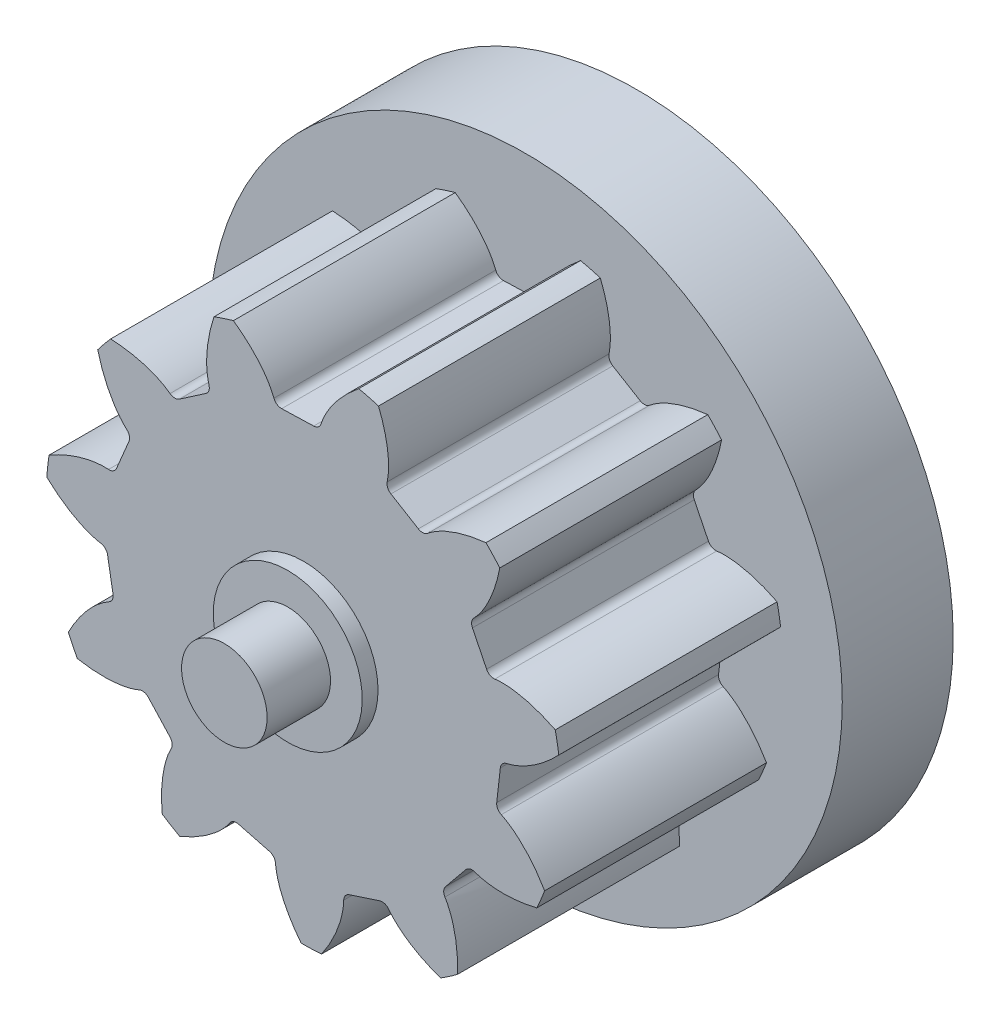
from build123d import *

# Parameters (mm, degrees)
SKETCH2_R                = 8.125
BOSS_EXTRUDE1_DEPTH      = 7
CUT_EXTRUDE1_DEPTH       = 7
FILLET1_R                = 0.254
CIRPATTERN3_COUNT        = 11
FILLET1_OF_CIRPATTERN3_R = 0.254
SKETCH10_R               = 1.8
CUT_EXTRUDE3_DEPTH       = 4
BOSS_EXTRUDE2_START      = 3.5
SKETCH11_R               = 10
SKETCH11_R_2             = 1.8
BOSS_EXTRUDE2_DEPTH      = 3.5
SKETCH12_R               = 3.3
CUT_EXTRUDE4_DEPTH       = 2.5


# Read off the part's stored shape, not the designer's step: Cut-Extrude1
with BuildPart() as part:
    # Sketch2 → Boss-Extrude1 (new body)
    with BuildSketch(Plane.XY):
        Circle(SKETCH2_R)
    extrude(amount=BOSS_EXTRUDE1_DEPTH)

    # Cut-Extrude1 outline → Cut-Extrude1 (cut)
    with BuildSketch(Plane.XY):
        with BuildLine():
            add(Edge.make_bspline(
                [(6.230866036, 0), (6.235473566, 0), (6.248392879, 0.000301816), (6.272788752, 0.002063982), (6.312468264, 0.006627701), (6.362772665, 0.014915466), (6.427377148, 0.028451165), (6.502836081, 0.04800427), (6.584940383, 0.073240914), (6.673231189, 0.104698853), (6.760286137, 0.139587561), (6.846067267, 0.177612608), (6.93049542, 0.218374425), (7.031447847, 0.271104951), (7.150597351, 0.338972511), (7.28681308, 0.424902383), (7.437483479, 0.530044423), (7.586576545, 0.645159253), (7.729488298, 0.764898307), (7.865628813, 0.88978132), (7.961316066, 0.983260547), (8.023830686, 1.04791121), (8.053063977, 1.078788946)],
                knots=[0, 0, 0, 0, 0, 0.005376748, 0.015083688, 0.02853182, 0.046610139, 0.064854849, 0.092110525, 0.119476175, 0.146842495, 0.174208853, 0.201574955, 0.228941013, 0.256307345, 0.307035032, 0.361767351, 0.41649966, 0.471231936, 0.525964281, 0.580696615, 0.629881812, 0.629881812, 0.629881812, 0.629881812, 0.629881812], degree=4))
            Line((6.230866036, 0), (6.072908509, -1.39408529))
            add(Edge.make_bspline(
                [(7.607545512, -2.853222087), (7.585961851, -2.816586512), (7.539496877, -2.739587861), (7.467150286, -2.627069476), (7.362402195, -2.47489246), (7.249903621, -2.326214012), (7.130345817, -2.180659561), (7.007019369, -2.044472173), (6.89348265, -1.930243975), (6.792538275, -1.837438569), (6.70594293, -1.76345785), (6.632775091, -1.70483954), (6.557676253, -1.648585909), (6.48063417, -1.595104105), (6.401619963, -1.544689589), (6.327243484, -1.501722811), (6.258072281, -1.465782317), (6.198134032, -1.438135242), (6.150959182, -1.418802542), (6.113306658, -1.405476679), (6.089923505, -1.398300886), (6.077399235, -1.395116172), (6.072908509, -1.39408529)],
                knots=[0.279209104, 0.279209104, 0.279209104, 0.279209104, 0.279209104, 0.328394301, 0.383126635, 0.43785898, 0.492591256, 0.547323565, 0.602055884, 0.652783571, 0.680149903, 0.707515961, 0.734882063, 0.762248421, 0.789614741, 0.816980391, 0.844236067, 0.862480777, 0.880559096, 0.894007228, 0.903714168, 0.909090916, 0.909090916, 0.909090916, 0.909090916, 0.909090916], degree=4))
            ThreePointArc((7.607545512, -2.853222087), (8.07334194, -0.914754021), (8.053063977, 1.078788946))
        make_face()
    cut_extrude1 = extrude(amount=CUT_EXTRUDE1_DEPTH, mode=Mode.SUBTRACT)

    # Fillet1
    fillet1_edges = [part.edges().sort_by_distance(p)[0] for p in [
        (6.072908509, -1.39408529, 3.5),
        (6.230866036, 0, 3.5),
    ]]
    fillet(fillet1_edges, radius=FILLET1_R)

    # CirPattern3: Cut-Extrude1 ×11 about axis
    cirpattern3_axis = Axis((0, 0, 18.908609159), (0, 0, -1))
    for i in range(1, CIRPATTERN3_COUNT):
        add(cut_extrude1.rotate(cirpattern3_axis, i * 360 / CIRPATTERN3_COUNT), mode=Mode.SUBTRACT)

    # Fillet1 of CirPattern3
    fillet1_of_cirpattern3_edges = [part.edges().sort_by_distance(p)[0] for p in [
        (4.355156327, -4.456041396, 3.5),
        (5.241738065, -3.368660507, 3.5),
        (1.254672783, -6.103235844, 3.5),
        (2.588395295, -5.667795105, 3.5),
        (-2.244160504, -5.812696034, 3.5),
        (-0.886744692, -6.167444804, 3.5),
        (-5.030488688, -3.676666305, 3.5),
        (-4.080349505, -4.708974355, 3.5),
        (-6.219672257, -0.373321001, 3.5),
        (-5.978472181, -1.75543782, 3.5),
        (-5.434153831, 3.048551082, 3.5),
        (-5.978472181, 1.75543782, 3.5),
        (-2.923329959, 5.502529737, 3.5),
        (-4.080349505, 4.708974355, 3.5),
        (0.51563052, 6.209494079, 3.5),
        (-0.886744692, 6.167444804, 3.5),
        (3.790881951, 4.944987926, 3.5),
        (2.588395295, 5.667795105, 3.5),
        (5.862555149, 2.110483045, 3.5),
        (5.241738065, 3.368660507, 3.5),
    ]]
    fillet(fillet1_of_cirpattern3_edges, radius=FILLET1_OF_CIRPATTERN3_R)

    # Sketch9 → Revolve1 (revolve)
    with BuildSketch(Plane(origin=(0, 0, 0), x_dir=(0, 0, -1), z_dir=(1, 0, 0))):
        Polygon((-9.5, 0), (-9.5, 1.35), (-7.5, 1.35), (-7.5, 2.35), (-7, 2.35), (-7, 0), align=None)
    revolve(axis=Axis((0, 0, 7), (0, 0, 1)))

    # Sketch10 → Cut-Extrude3 (cut)
    with BuildSketch(Plane(origin=(0, 0, 0), x_dir=(-1, 0, 0), z_dir=(0, 0, -1))):
        Circle(SKETCH10_R)
    extrude(amount=-CUT_EXTRUDE3_DEPTH, mode=Mode.SUBTRACT)

    # Sketch11 → Boss-Extrude2 (add)
    with BuildSketch(Plane(origin=(0, 0, 0), x_dir=(-1, 0, 0), z_dir=(0, 0, -1)).offset(BOSS_EXTRUDE2_START)):
        Circle(SKETCH11_R)
        Circle(SKETCH11_R_2, mode=Mode.SUBTRACT)
    extrude(amount=-BOSS_EXTRUDE2_DEPTH)

    # Sketch12 → Cut-Extrude4 (cut)
    with BuildSketch(Plane(origin=(0, 0, -3.5), x_dir=(-1, 0, 0), z_dir=(0, 0, -1))):
        with Locations((0, 6)):
            Circle(SKETCH12_R)
        with Locations((0, -6)):
            Circle(SKETCH12_R)
        with Locations((-6, 0)):
            Circle(SKETCH12_R)
        with Locations((6, 0)):
            Circle(SKETCH12_R)
    extrude(amount=-CUT_EXTRUDE4_DEPTH, mode=Mode.SUBTRACT)


solid = part.part
